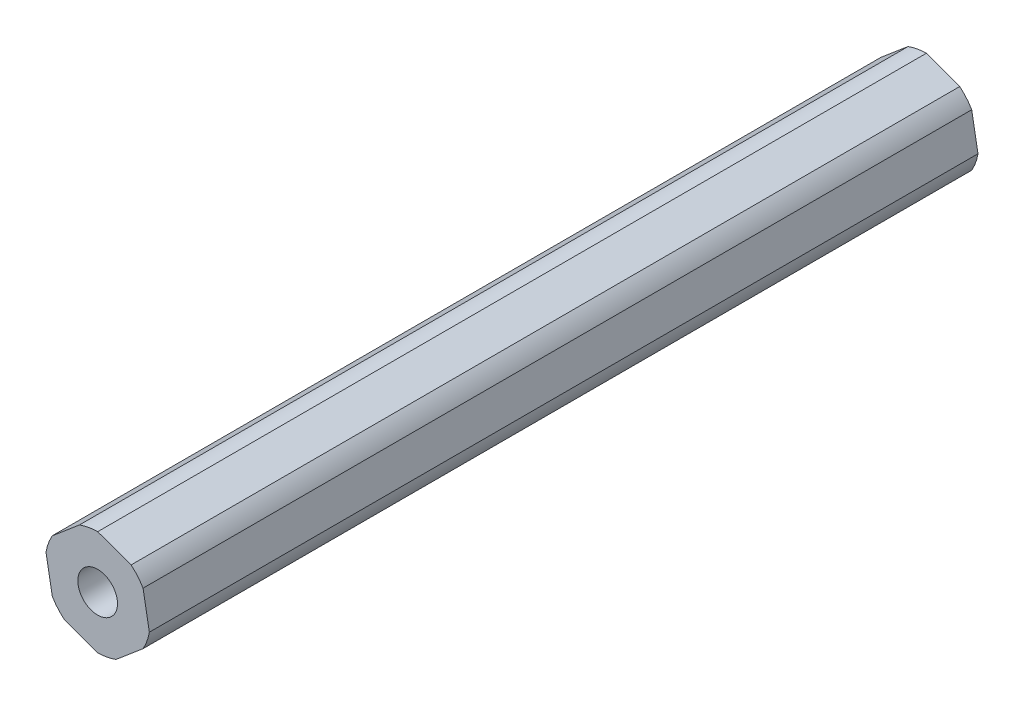
from build123d import *

# Parameters (mm, degrees)
BOSS_EXTRUDE1_DEPTH         = 106.7181
SKETCH2_R                   = 2.0193
CUT_EXTRUDE1_DEPTH          = 108.138220451
F_1_4_20_TAPPED_HOLE1_D     = 5.1054
F_1_4_20_TAPPED_HOLE1_DEPTH = 19.05
F_1_4_20_TAPPED_HOLE1_TIP   = 1.533816902
F_1_4_20_TAPPED_HOLE2_D     = 5.1054
F_1_4_20_TAPPED_HOLE2_DEPTH = 19.05
F_1_4_20_TAPPED_HOLE2_TIP   = 1.533816902


with BuildPart() as part:
    # Sketch1 → Boss-Extrude1 (new body)
    with BuildSketch(Plane.XY):
        with BuildLine():
            Line((-6.654540832, 1.131188008), (-5.845671476, -3.375))
            ThreePointArc((-5.845671476, -3.375), (-5.15742276, -4.354709), (-4.306907968, -5.197407407))
            Line((-4.306907968, -5.197407407), (0, -6.75))
            ThreePointArc((0, -6.75), (1.19257724, -6.643813628), (2.347632865, -6.328595415))
            Line((2.347632865, -6.328595415), (5.845671476, -3.375))
            ThreePointArc((5.845671476, -3.375), (6.35, -2.289104628), (6.654540832, -1.131188008))
            Line((6.654540832, -1.131188008), (5.845671476, 3.375))
            ThreePointArc((5.845671476, 3.375), (5.15742276, 4.354709), (4.306907968, 5.197407407))
            Line((4.306907968, 5.197407407), (0, 6.75))
            ThreePointArc((0, 6.75), (-1.19257724, 6.643813628), (-2.347632865, 6.328595415))
            Line((-2.347632865, 6.328595415), (-5.845671476, 3.375))
            ThreePointArc((-5.845671476, 3.375), (-6.35, 2.289104628), (-6.654540832, 1.131188008))
        make_face()
    extrude(amount=BOSS_EXTRUDE1_DEPTH)

    # Sketch2 → Cut-Extrude1 (cut, through all)
    with BuildSketch(Plane.XY.offset(106.7181)):
        Circle(SKETCH2_R)
    extrude(amount=-CUT_EXTRUDE1_DEPTH, mode=Mode.SUBTRACT)

    # 1/4-20 Tapped Hole1
    with Locations(Plane.XY.offset(106.7181)):
        with Locations((0, 0)):
            Hole(F_1_4_20_TAPPED_HOLE1_D / 2, depth=F_1_4_20_TAPPED_HOLE1_DEPTH)
            with Locations((0, 0, -(F_1_4_20_TAPPED_HOLE1_DEPTH + F_1_4_20_TAPPED_HOLE1_TIP / 2))):  # 118° drill point
                Cone(0, F_1_4_20_TAPPED_HOLE1_D / 2, F_1_4_20_TAPPED_HOLE1_TIP, mode=Mode.SUBTRACT)

    # 1/4-20 Tapped Hole2
    with Locations(Plane(origin=(0, 0, 0), x_dir=(-1, 0, 0), z_dir=(0, 0, -1))):
        with Locations((0, 0)):
            Hole(F_1_4_20_TAPPED_HOLE2_D / 2, depth=F_1_4_20_TAPPED_HOLE2_DEPTH)
            with Locations((0, 0, -(F_1_4_20_TAPPED_HOLE2_DEPTH + F_1_4_20_TAPPED_HOLE2_TIP / 2))):  # 118° drill point
                Cone(0, F_1_4_20_TAPPED_HOLE2_D / 2, F_1_4_20_TAPPED_HOLE2_TIP, mode=Mode.SUBTRACT)


solid = part.part
